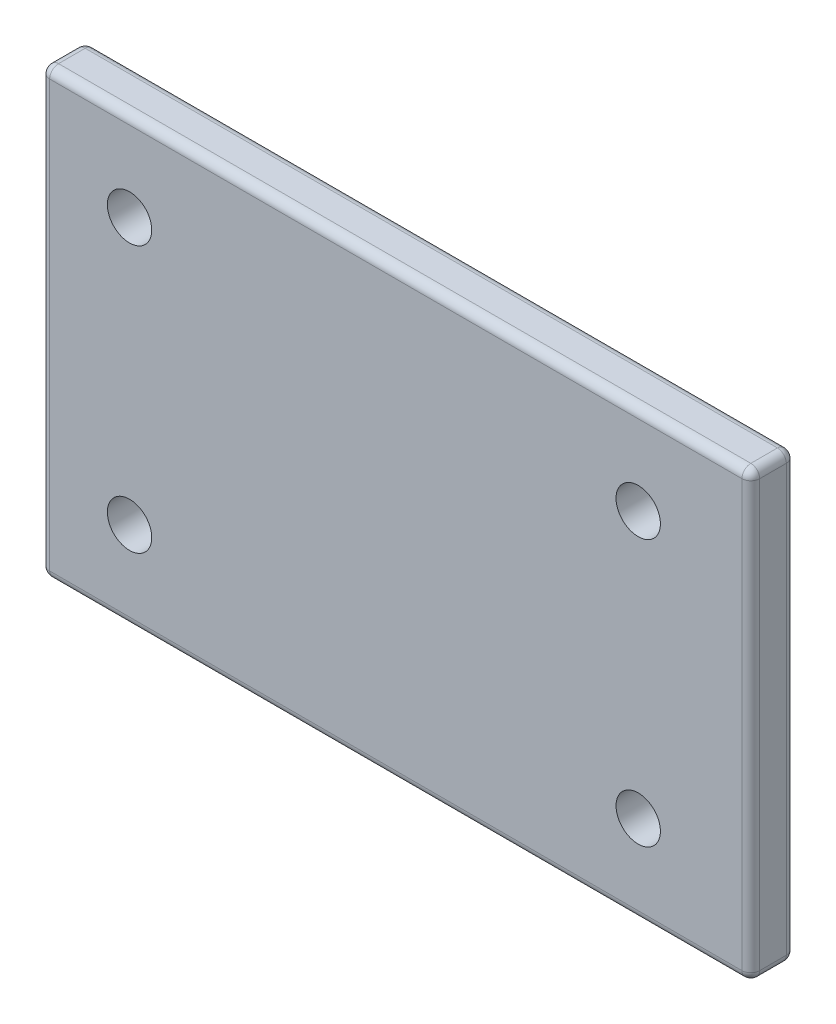
from build123d import *

# Parameters (mm, degrees)
SKETCH1_W           = 160
SKETCH1_H           = 100
BOSS_EXTRUDE2_DEPTH = 10
SKETCH2_R           = 5
CUT_EXTRUDE1_DEPTH  = 10
FILLET3_R           = 2
FILLET4_R           = 2
FILLET5_R           = 2
FILLET6_R           = 2


with BuildPart() as part:
    # Sketch1 → Boss-Extrude2 (new body)
    with BuildSketch(Plane.XY):
        Rectangle(SKETCH1_W, SKETCH1_H)
    extrude(amount=BOSS_EXTRUDE2_DEPTH)

    # Sketch2 → Cut-Extrude1 (cut)
    with BuildSketch(Plane.XY.offset(10)):
        with Locations((-60, 30)):
            Circle(SKETCH2_R)
        with Locations(Location((54.624761616, 30, 0), (0, 0, 180))):
            Circle(SKETCH2_R)
        with Locations((54.624761616, -30)):
            Circle(SKETCH2_R)
        with Locations(Location((-60, -30, 0), (0, 0, 180))):
            Circle(SKETCH2_R)
    extrude(amount=-CUT_EXTRUDE1_DEPTH, mode=Mode.SUBTRACT)

    # Fillet3
    fillet3_edges = [part.edges().sort_by_distance(p)[0] for p in [
        (0, 50, 10),
        (-80, 0, 10),
        (-80, 50, 5),
    ]]
    fillet(fillet3_edges, radius=FILLET3_R)

    # Fillet4
    fillet4_edges = [part.edges().sort_by_distance(p)[0] for p in [
        (80, -1, 10),
        (80, 50, 4),
        (80, 49.414213562, 9.414213562),
        (80, 0, 0),
    ]]
    fillet(fillet4_edges, radius=FILLET4_R)

    # Fillet5
    fillet5_edges = [part.edges().sort_by_distance(p)[0] for p in [
        (0, -50, 10),
        (-80, -50, 4),
        (-79.414213562, -50, 9.414213562),
        (80, -50, 5),
        (79.414213562, -50, 9.414213562),
        (79.414213562, -50, 0.585786438),
        (-1, -50, 0),
    ]]
    fillet(fillet5_edges, radius=FILLET5_R)

    # Fillet6
    # the kernel refuses this fillet: 2 mm, written as the material it takes off along each edge
    with BuildSketch(Plane(origin=(78, 48, 2), x_dir=(0, 1, 0), z_dir=(0, 0, -1))) as fillet6_piece_1_section:
        Polygon((0, 0), (FILLET6_R, 0), (FILLET6_R, FILLET6_R), (0, FILLET6_R), align=None)
    fillet6_piece_1 = extrude(amount=FILLET6_R, mode=Mode.PRIVATE)
    fillet6_piece_1 = fillet6_piece_1 - Plane(origin=(78, 48, 2), x_dir=(-0.7071067811865475, -0.7071067811865476, 0), z_dir=(0, 0, -1)) * Sphere(FILLET6_R, mode=Mode.PRIVATE)
    add(fillet6_piece_1, mode=Mode.SUBTRACT)
    with BuildSketch(Plane(origin=(-78, -48, 2), x_dir=(-1, 0, 0), z_dir=(0, 0, -1))) as fillet6_piece_2_section:
        Polygon((0, 0), (FILLET6_R, 0), (FILLET6_R, -FILLET6_R), (0, -FILLET6_R), align=None)
    fillet6_piece_2 = extrude(amount=FILLET6_R, mode=Mode.PRIVATE)
    fillet6_piece_2 = fillet6_piece_2 - Plane(origin=(-78, -48, 2), x_dir=(0.7071067811865475, 0.7071067811865475, 0), z_dir=(0, 0, -1)) * Sphere(FILLET6_R, mode=Mode.PRIVATE)
    add(fillet6_piece_2, mode=Mode.SUBTRACT)
    with BuildSketch(Plane(origin=(-80, -48, 0), x_dir=(1, 0, 0), z_dir=(0, 1, 0))) as fillet6_piece_3:
        with BuildLine():
            CenterArc((FILLET6_R, -FILLET6_R), FILLET6_R, 90, 90)
            Line((0, -FILLET6_R), (0, 0))
            Line((0, 0), (FILLET6_R, 0))
        make_face()
    extrude(amount=96, mode=Mode.SUBTRACT)
    with BuildSketch(Plane(origin=(-78, 48, 0), x_dir=(-1, 0, 0), z_dir=(0, -1, 0))) as fillet6_piece_4:
        with BuildLine():
            CenterArc((2 - FILLET6_R, -FILLET6_R), FILLET6_R, 0, 90)
            Line((2, -FILLET6_R), (2, 0))
            Line((2, 0), (2 - FILLET6_R, 0))
        make_face()
    revolve(axis=Axis((-78, 48, 0), (0, 0, -1)), revolution_arc=90, mode=Mode.SUBTRACT)
    with BuildSketch(Plane(origin=(-78, 50, 0), x_dir=(0, -1, 0), z_dir=(1, 0, 0))) as fillet6_piece_5:
        with BuildLine():
            CenterArc((FILLET6_R, -FILLET6_R), FILLET6_R, 90, 90)
            Line((0, -FILLET6_R), (0, 0))
            Line((0, 0), (FILLET6_R, 0))
        make_face()
    extrude(amount=156, mode=Mode.SUBTRACT)


solid = part.part
